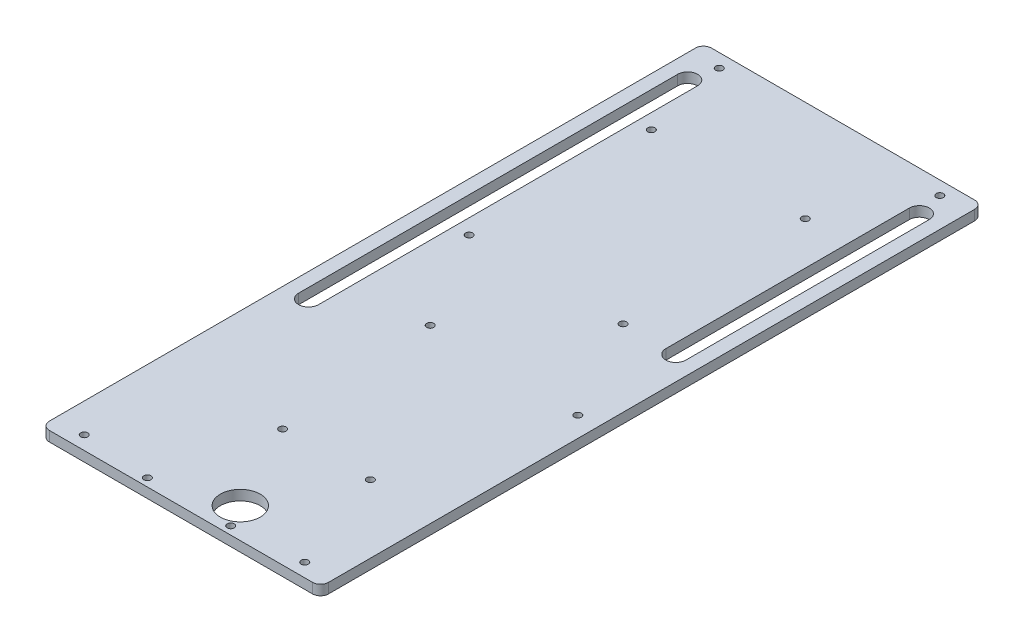
from build123d import *

# Parameters (mm, degrees)
SKETCH2_W           = 88.9
SKETCH2_H           = 3.2004
BOSS_EXTRUDE1_DEPTH = 210.82
SKETCH3_R           = 1.1303
SKETCH3_R_2         = 6.35
CUT_EXTRUDE1_DEPTH  = 216.82004684
FILLET2_R           = 2.54


with BuildPart() as part:
    # Sketch2 → Boss-Extrude1 (new body)
    with BuildSketch(Plane.XY):
        with Locations((-1.625781684, -22.993244248)):
            Rectangle(SKETCH2_W, SKETCH2_H)
    extrude(amount=BOSS_EXTRUDE1_DEPTH)

    # Sketch3 → Cut-Extrude1 (cut, through all)
    with BuildSketch(Plane(origin=(0, -21.393044248, 0), x_dir=(-1, 0, 0), z_dir=(0, 1, 0))):
        with Locations((14.833781684, 208.28)):
            Circle(SKETCH3_R)
        with Locations((-11.683818316, 208.28)):
            Circle(SKETCH3_R)
        with Locations((-7.619818316, 201.168)):
            Circle(SKETCH3_R_2)
        with Locations((-33.478453416, 206.502)):
            Circle(SKETCH3_R)
        with Locations((36.730016784, 206.502)):
            Circle(SKETCH3_R)
        with Locations((-33.478453416, 4.318)):
            Circle(SKETCH3_R)
        with Locations((36.730016784, 4.318)):
            Circle(SKETCH3_R)
        with Locations((-18.450986138, 32.12110162)):
            Circle(SKETCH3_R)
        with Locations((-18.450986138, 90.12110162)):
            Circle(SKETCH3_R)
        with Locations((30.549013862, 90.12110162)):
            Circle(SKETCH3_R)
        with Locations((30.549013862, 32.12110162)):
            Circle(SKETCH3_R)
        with Locations((-21.181379204, 173.304632562)):
            Circle(SKETCH3_R)
        with Locations((-36.421379204, 122.504632562)):
            Circle(SKETCH3_R)
        with Locations((6.758620796, 173.304632562)):
            Circle(SKETCH3_R)
        with Locations((11.838620796, 121.234632562)):
            Circle(SKETCH3_R)
        with Locations((81.579081393, -113.266782514)):
            Circle(SKETCH3_R)
        with Locations((66.769810529, -163.717742064)):
            Circle(SKETCH3_R)
        with Locations((108.318194793, -113.266782514)):
            Circle(SKETCH3_R)
        with Locations((97.604440284, -108.476314785)):
            Circle(SKETCH3_R)
        with Locations((82.79516942, -158.927274335)):
            Circle(SKETCH3_R)
        with Locations((124.343553684, -108.476314785)):
            Circle(SKETCH3_R)
        with Locations((112.789811005, -158.927274335)):
            Circle(SKETCH3_R)
        with BuildLine():
            Line((35.32929924, 12.595958552), (35.32929924, 133.302587666))
            ThreePointArc((35.32929924, 133.302587666), (38.50429924, 136.477587666), (41.67929924, 133.302587666))
            Line((41.67929924, 133.302587666), (41.67929924, 12.595958552))
            ThreePointArc((41.67929924, 12.595958552), (38.50429924, 9.420958552), (35.32929924, 12.595958552))
        make_face()
        with BuildLine():
            Line((-32.077737936, 12.595958552), (-32.077737936, 90.122587598))
            ThreePointArc((-32.077737936, 90.122587598), (-35.252737936, 93.297587598), (-38.427737936, 90.122587598))
            Line((-38.427737936, 90.122587598), (-38.427737936, 12.595958552))
            ThreePointArc((-38.427737936, 12.595958552), (-35.252737936, 9.420958552), (-32.077737936, 12.595958552))
        make_face()
    extrude(amount=-CUT_EXTRUDE1_DEPTH, mode=Mode.SUBTRACT)

    # Fillet2
    fillet2_edges = [part.edges().sort_by_distance(p)[0] for p in [
        (42.824218316, -22.993244248, 210.82),
        (-46.075781684, -22.993244248, 210.82),
        (-46.075781684, -22.993244248, 0),
        (42.824218316, -22.993244248, 0),
    ]]
    fillet(fillet2_edges, radius=FILLET2_R)


solid = part.part
